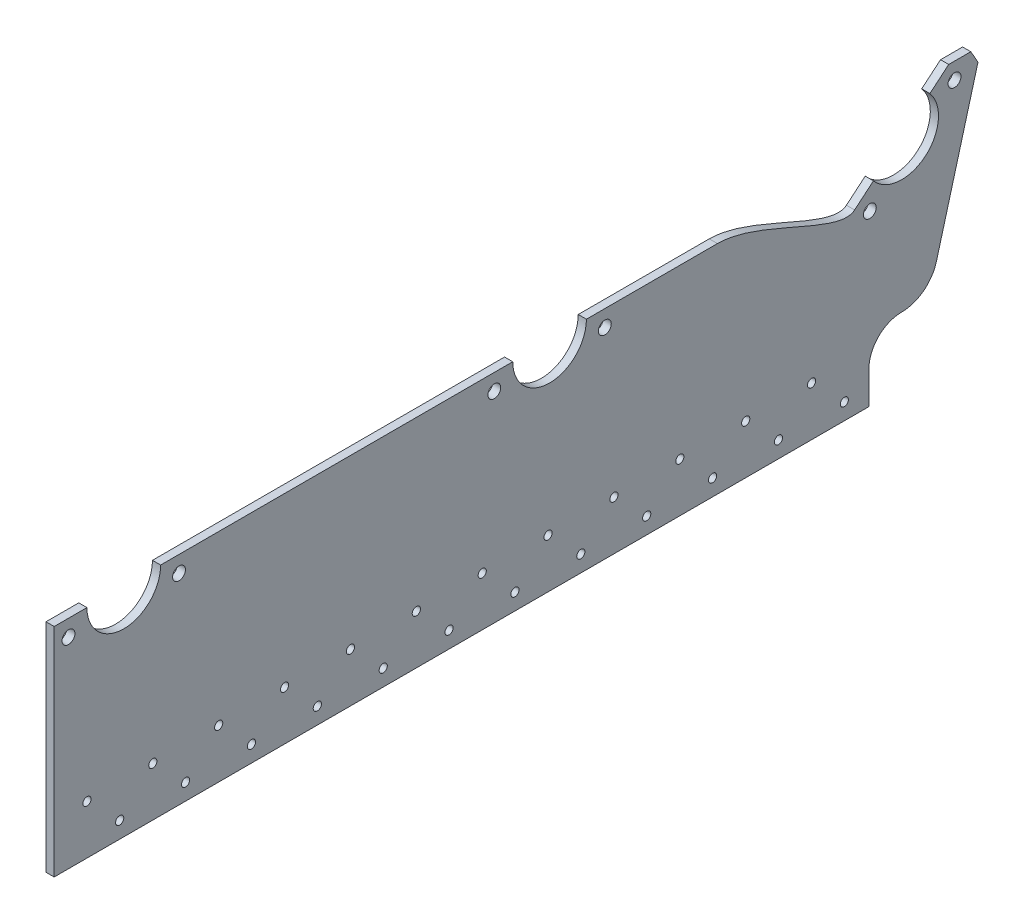
from build123d import *

# Parameters (mm, degrees)
BOSS_EXTRUDE1_DEPTH    = 3.175
F_10_CLEARANCE_HOLE1_D = 4.9784
CHAMFER1_SIZE          = 5.08
CHAMFER1_SIZE2         = 4.134495326
SKETCH4_R              = 1.5875
CUT_EXTRUDE1_DEPTH     = 340.883816428


with BuildPart() as part:
    # Sketch1 → Boss-Extrude1 (new body)
    with BuildSketch(Plane(origin=(0, 0, 0), x_dir=(0, 0, -1), z_dir=(1, 0, 0))):
        with BuildLine():
            Line((-12.7, -12.7), (-328.6125, -12.7))
            Line((-328.6125, -12.7), (-328.6125, 71.4375))
            Line((-328.6125, 71.4375), (-315.9125, 71.4375))
            ThreePointArc((-315.9125, 71.4375), (-301.625, 57.15), (-287.3375, 71.4375))
            Line((-287.3375, 71.4375), (-150.8125, 71.4375))
            ThreePointArc((-150.8125, 71.4375), (-136.525, 57.15), (-122.2375, 71.4375))
            Line((-122.2375, 71.4375), (-71.4375, 71.4375))
            add(Edge.make_bspline(
                [(-18.243165022, 56.129666959), (-24.729007974, 50.68739853), (-54.504166667, 71.4375), (-71.4375, 71.4375)],
                knots=[0, 0, 0, 0, 1, 1, 1, 1], degree=3))
            Line((-18.243165022, 56.129666959), (-10.944859981, 62.253672027))
            ThreePointArc((-10.944859981, 62.253672027), (9.183827973, 60.492640019), (10.944859981, 80.621327973))
            Line((10.944859981, 80.621327973), (18.243165022, 86.745333041))
            Line((18.243165022, 86.745333041), (30.943165022, 86.745333041))
            Line((30.943165022, 86.745333041), (13.473517024, 22.978761859))
            ThreePointArc((13.473517024, 22.978761859), (8.473319986, 15.563076555), (0, 12.7))
            ThreePointArc((0, 12.7), (-8.980256121, 8.980256121), (-12.7, 0))
            Line((-12.7, 0), (-12.7, -12.7))
        make_face()
    extrude(amount=BOSS_EXTRUDE1_DEPTH)

    # #10 Clearance Hole1 (through all)
    with Locations(Plane(origin=(3.175, 0, 0), x_dir=(0, 0, -1), z_dir=(1, 0, 0))):
        with Locations((-323.05625, 65.0875), (-280.19375, 65.0875), (-157.95625, 65.0875), (-115.09375, 65.0875), (-12.33558865, 52.797375826), (20.498991293, 80.348859746)):
            Hole(F_10_CLEARANCE_HOLE1_D / 2)

    # Chamfer1
    chamfer1_edges = [part.edges().sort_by_distance(p)[0] for p in [
        (1.5875, 86.745333041, -30.943165022),
    ]]
    chamfer1_side = [part.faces().sort_by_distance(p)[0] for p in [
        (1.5875, 54.86204745, -22.208341023),
    ]]
    chamfer(chamfer1_edges, length=CHAMFER1_SIZE, length2=CHAMFER1_SIZE2, reference=chamfer1_side[0])

    # Sketch4 → Cut-Extrude1 (cut, through all)
    with BuildSketch(Plane(origin=(3.175, 0, 0), x_dir=(0, 0, -1), z_dir=(1, 0, 0))):
        with Locations((-315.9125, 6.35)):
            Circle(SKETCH4_R)
        with Locations((-303.2125, -6.35)):
            Circle(SKETCH4_R)
        with Locations((-290.368181818, 6.35)):
            Circle(SKETCH4_R)
        with Locations((-277.668181818, -6.35)):
            Circle(SKETCH4_R)
        with Locations((-264.823863636, 6.35)):
            Circle(SKETCH4_R)
        with Locations((-252.123863636, -6.35)):
            Circle(SKETCH4_R)
        with Locations((-239.279545455, 6.35)):
            Circle(SKETCH4_R)
        with Locations((-226.579545455, -6.35)):
            Circle(SKETCH4_R)
        with Locations((-213.735227273, 6.35)):
            Circle(SKETCH4_R)
        with Locations((-201.035227273, -6.35)):
            Circle(SKETCH4_R)
        with Locations((-188.190909091, 6.35)):
            Circle(SKETCH4_R)
        with Locations((-175.490909091, -6.35)):
            Circle(SKETCH4_R)
        with Locations((-162.646590909, 6.35)):
            Circle(SKETCH4_R)
        with Locations((-149.946590909, -6.35)):
            Circle(SKETCH4_R)
        with Locations((-137.102272727, 6.35)):
            Circle(SKETCH4_R)
        with Locations((-124.402272727, -6.35)):
            Circle(SKETCH4_R)
        with Locations((-111.557954545, 6.35)):
            Circle(SKETCH4_R)
        with Locations((-98.857954545, -6.35)):
            Circle(SKETCH4_R)
        with Locations((-86.013636364, 6.35)):
            Circle(SKETCH4_R)
        with Locations((-73.313636364, -6.35)):
            Circle(SKETCH4_R)
        with Locations((-60.469318182, 6.35)):
            Circle(SKETCH4_R)
        with Locations((-47.769318182, -6.35)):
            Circle(SKETCH4_R)
        with Locations((-34.925, 6.35)):
            Circle(SKETCH4_R)
        with Locations((-22.225, -6.35)):
            Circle(SKETCH4_R)
    extrude(amount=-CUT_EXTRUDE1_DEPTH, mode=Mode.SUBTRACT)


solid = part.part
